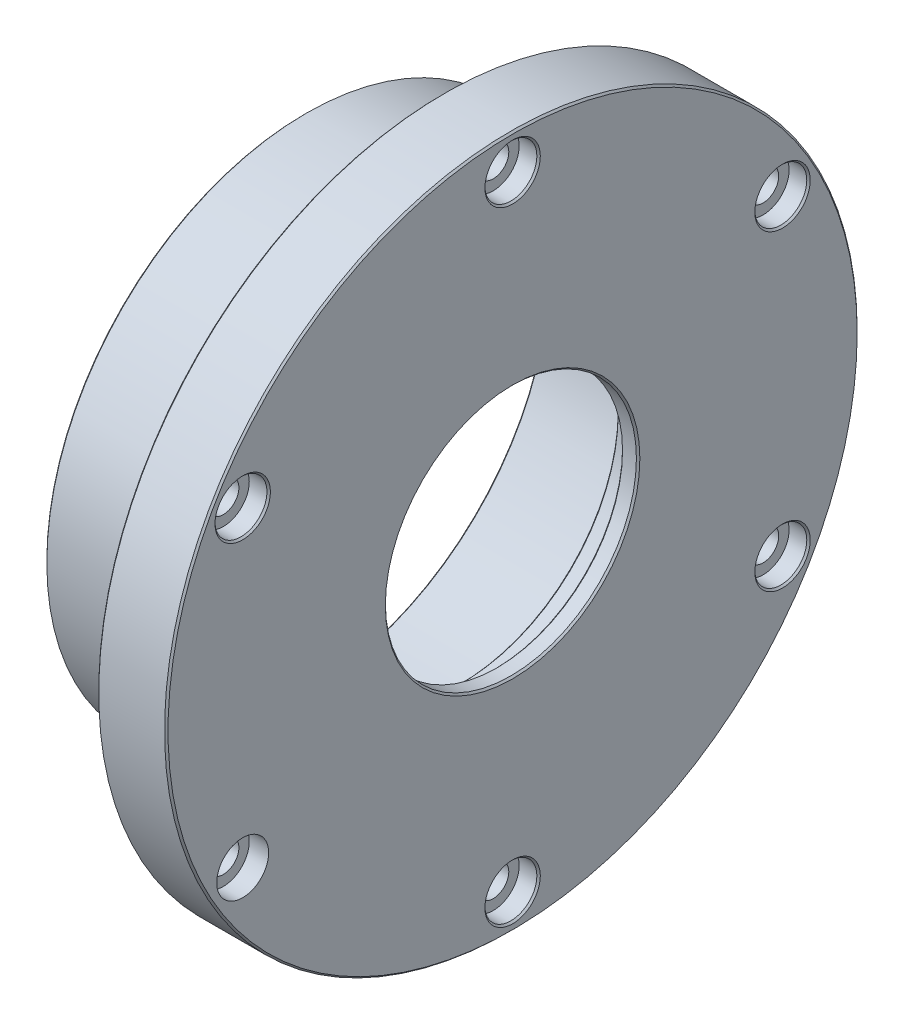
from build123d import *

# Parameters (mm, degrees)
CBORE_FOR_M8_HEX_SOCKET_THIN_HEAD_CAP_SC_D           = 9
CBORE_FOR_M8_HEX_SOCKET_THIN_HEAD_CAP_SC_DEPTH       = 20
CBORE_FOR_M8_HEX_SOCKET_THIN_HEAD_CAP_SC_CBORE_D     = 15
CBORE_FOR_M8_HEX_SOCKET_THIN_HEAD_CAP_SC_CBORE_DEPTH = 5.6
CBORE_FOR_M8_HEX_SOCKET_THIN_HEAD_CAP_SC_TIP         = 2.703872786
CHAMFER1_SIZE                                        = 0.5


with BuildPart() as part:
    # Sketch1 → Revolve1 (revolve)
    with BuildSketch(Plane.XY):
        Polygon((42.938748471, 66.816763283), (22.938748471, 66.816763283), (22.938748471, 41.816763283), (-17.061251529, 41.816763283), (-17.061251529, 36.816763283), (21.938748471, 36.816763283), (21.938748471, 26.816763283), (27.938748471, 26.816763283), (27.938748471, 11.816763283), (37.938748471, 11.816763283), (37.938748471, 3.066763283), (42.938748471, 3.066763283), align=None)
    revolve(axis=Axis((-15.261904536, -33.183236717, 0), (1, 0, 0)))

    # CBORE for M8 Hex Socket Thin Head Cap Screw1
    with Locations(Plane(origin=(42.938748471, 0, 0), x_dir=(0, 0, -1), z_dir=(1, 0, 0))):
        with Locations((77.942286341, 11.816763283), (0, 56.816763283), (0, -33.183236717), (-77.942286341, 11.816763283), (-77.942286341, -78.183236717), (0, -123.183236717), (77.942286341, -78.183236717)):
            CounterBoreHole(CBORE_FOR_M8_HEX_SOCKET_THIN_HEAD_CAP_SC_D / 2, CBORE_FOR_M8_HEX_SOCKET_THIN_HEAD_CAP_SC_CBORE_D / 2, CBORE_FOR_M8_HEX_SOCKET_THIN_HEAD_CAP_SC_CBORE_DEPTH, depth=CBORE_FOR_M8_HEX_SOCKET_THIN_HEAD_CAP_SC_DEPTH)
            with Locations((0, 0, -(CBORE_FOR_M8_HEX_SOCKET_THIN_HEAD_CAP_SC_DEPTH + CBORE_FOR_M8_HEX_SOCKET_THIN_HEAD_CAP_SC_TIP / 2))):  # 118° drill point
                Cone(0, CBORE_FOR_M8_HEX_SOCKET_THIN_HEAD_CAP_SC_D / 2, CBORE_FOR_M8_HEX_SOCKET_THIN_HEAD_CAP_SC_TIP, mode=Mode.SUBTRACT)

    # Chamfer1
    chamfer1_edges = [part.edges().sort_by_distance(p)[0] for p in [
        (22.938748471, -133.183236717, 0),
        (-17.061251529, -108.183236717, 0),
        (22.938748471, -123.183236717, -4.5),
        (22.938748471, -78.183236717, -82.442286341),
        (22.938748471, 11.816763283, -82.442286341),
        (22.938748471, 56.816763283, -4.5),
        (22.938748471, 11.816763283, 73.442286341),
        (22.938748471, -78.183236717, 73.442286341),
        (42.938748471, -123.183236717, 7.5),
        (42.938748471, -78.183236717, -70.442286341),
        (42.938748471, 11.816763283, -70.442286341),
        (42.938748471, 56.816763283, 7.5),
        (42.938748471, 11.816763283, 85.442286341),
        (-17.061251529, -103.183236717, 0),
        (42.938748471, -69.433236717, 0),
        (42.938748471, -133.183236717, 0),
        (37.938748471, -69.433236717, 0),
        (27.938748471, -78.183236717, 0),
        (21.938748471, -93.183236717, 0),
    ]]
    chamfer(chamfer1_edges, length=CHAMFER1_SIZE)


solid = part.part
